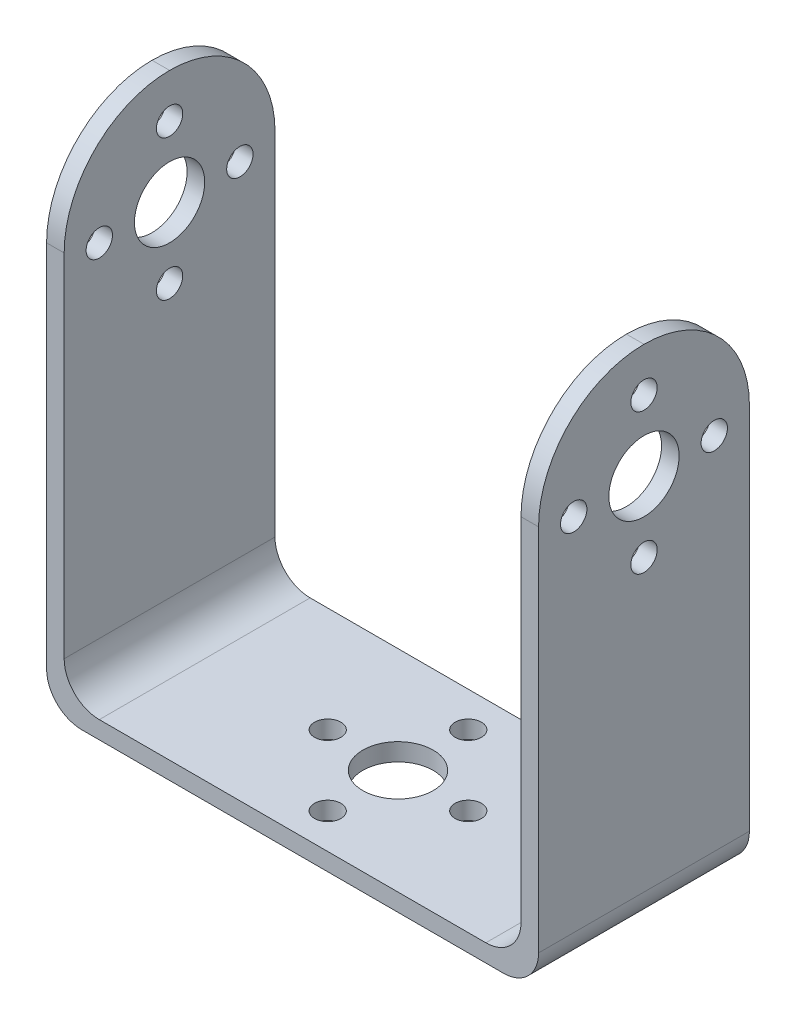
from build123d import *

# Parameters (mm, degrees)
BOSS_EXTRUDE1_DEPTH = 24
SKETCH2_R           = 4
SKETCH2_R_2         = 1.5
CUT_EXTRUDE1_DEPTH  = 19
CUT_EXTRUDE2_START  = -2
SKETCH3_R           = 4
SKETCH3_R_2         = 1.5
CUT_EXTRUDE2_DEPTH  = 2
FILLET1_R           = 12
SKETCH4_R           = 1.5
SKETCH4_R_2         = 4
CUT_EXTRUDE4_DEPTH  = 2
FILLET2_R           = 4


with BuildPart() as part:
    # Sketch1 → Boss-Extrude1 (new body)
    with BuildSketch(Plane.XY):
        Polygon((-78.301300665, 50.426714514), (-78.301300665, -5.573285486), (-26.301300665, -5.573285486), (-26.301300665, 50.426714514), (-24.301300665, 50.426714514), (-24.301300665, -7.573285486), (-80.301300665, -7.573285486), (-80.301300665, 50.426714514), align=None)
    extrude(amount=BOSS_EXTRUDE1_DEPTH)

    # Sketch2 → Cut-Extrude1 (cut)
    with BuildSketch(Plane(origin=(-24.301300665, 0, 0), x_dir=(0, 0, -1), z_dir=(1, 0, 0))):
        with Locations((-12, 37.426714514)):
            Circle(SKETCH2_R)
        with Locations((-4, 37.426714514)):
            Circle(SKETCH2_R_2)
        with Locations((-12, 29.426714514)):
            Circle(SKETCH2_R_2)
        with Locations((-20, 37.426714514)):
            Circle(SKETCH2_R_2)
        with Locations((-12, 45.426714514)):
            Circle(SKETCH2_R_2)
    extrude(amount=-CUT_EXTRUDE1_DEPTH, mode=Mode.SUBTRACT)

    # Sketch3 → Cut-Extrude2 (cut)
    with BuildSketch(Plane.ZY.offset(80.301300665).offset(CUT_EXTRUDE2_START)):
        with Locations(Location((12, 37.426714514, 0), (0, 0, 180))):
            Circle(SKETCH3_R)
        with Locations(Location((20, 37.426714514, 0), (0, 0, 180))):
            Circle(SKETCH3_R_2)
        with Locations(Location((12, 29.426714514, 0), (0, 0, 180))):
            Circle(SKETCH3_R_2)
        with Locations(Location((4, 37.426714514, 0), (0, 0, 180))):
            Circle(SKETCH3_R_2)
        with Locations(Location((12, 45.426714514, 0), (0, 0, 180))):
            Circle(SKETCH3_R_2)
    extrude(amount=CUT_EXTRUDE2_DEPTH, mode=Mode.SUBTRACT)

    # Fillet1
    fillet1_edges = [part.edges().sort_by_distance(p)[0] for p in [
        (-25.301300665, 50.426714514, 0),
        (-79.301300665, 50.426714514, 0),
        (-79.301300665, 50.426714514, 24),
        (-25.301300665, 50.426714514, 24),
    ]]
    fillet(fillet1_edges, radius=FILLET1_R - 0.0001)  # a hair under: the kernel refuses the full size

    # Sketch4 → Cut-Extrude4 (cut)
    with BuildSketch(Plane.XZ.offset(7.573285486)):
        with Locations(Location((-44.301300665, 12, 0), (0, 0, 270))):
            Circle(SKETCH4_R)
        with Locations(Location((-52.301300665, 4, 0), (0, 0, 270))):
            Circle(SKETCH4_R)
        with Locations(Location((-60.301300665, 12, 0), (0, 0, 270))):
            Circle(SKETCH4_R)
        with Locations(Location((-52.301300665, 12, 0), (0, 0, 270))):
            Circle(SKETCH4_R_2)
        with Locations(Location((-52.301300665, 20, 0), (0, 0, 270))):
            Circle(SKETCH4_R)
    extrude(amount=-CUT_EXTRUDE4_DEPTH, mode=Mode.SUBTRACT)

    # Fillet2
    fillet2_edges = [part.edges().sort_by_distance(p)[0] for p in [
        (-78.301300665, -5.573285486, 12),
        (-26.301300665, -5.573285486, 12),
        (-24.301300665, -7.573285486, 12),
        (-80.301300665, -7.573285486, 12),
    ]]
    fillet(fillet2_edges, radius=FILLET2_R)


solid = part.part
